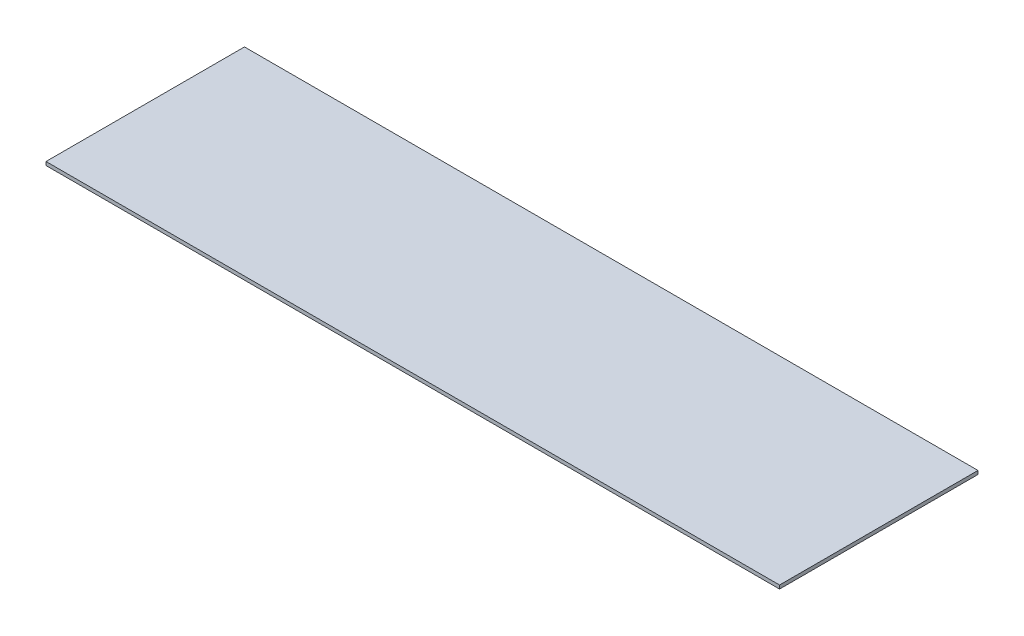
from build123d import *

# Parameters (mm, degrees)
SKETCH1_W          = 657.23516
SKETCH1_H          = 177.8
BASE_FLANGE1_DEPTH = 3.175


# Sheet-metal steps are written as plain solids
with BuildPart() as part:
    # Sketch1 → Base-Flange1 (new body)
    with BuildSketch(Plane(origin=(0, 0, 0), x_dir=(1, 0, 0), z_dir=(0, 1, 0))):
        Rectangle(SKETCH1_W, SKETCH1_H)
    extrude(amount=-BASE_FLANGE1_DEPTH)


solid = part.part
